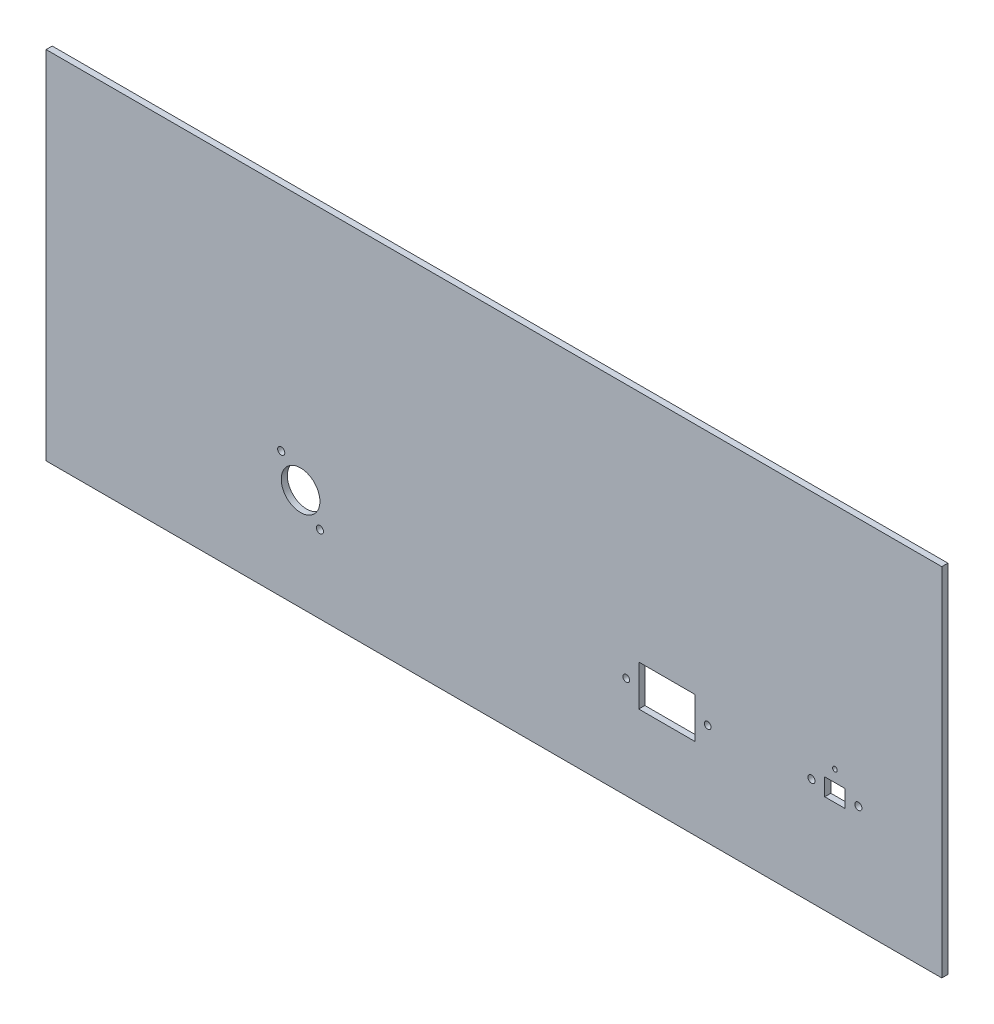
from build123d import *

# Parameters (mm, degrees)
SKETCH1_W           = 440
SKETCH1_H           = 175
SKETCH1_R           = 9.5
SKETCH1_R_2         = 1.75
SKETCH1_R_3         = 1.65
SKETCH1_R_4         = 1.15
SKETCH1_W_2         = 27.7
SKETCH1_H_2         = 20
SKETCH1_W_3         = 10
SKETCH1_H_3         = 8.5
BOSS_EXTRUDE1_DEPTH = 3


with BuildPart() as part:
    # Sketch1 → Boss-Extrude1 (new body)
    with BuildSketch(Plane.XY):
        with Locations((220, 87.5)):
            Rectangle(SKETCH1_W, SKETCH1_H)
        with Locations((125, 50)):
            Circle(SKETCH1_R, mode=Mode.SUBTRACT)
        with Locations((115.5, 62)):
            Circle(SKETCH1_R_2, mode=Mode.SUBTRACT)
        with Locations((134.5, 38)):
            Circle(SKETCH1_R_2, mode=Mode.SUBTRACT)
        with Locations((285, 50)):
            Circle(SKETCH1_R_3, mode=Mode.SUBTRACT)
        with Locations((325, 50)):
            Circle(SKETCH1_R_3, mode=Mode.SUBTRACT)
        with Locations((387.5, 62.593250583)):
            Circle(SKETCH1_R_4, mode=Mode.SUBTRACT)
        with Locations((376, 52.593250583)):
            Circle(SKETCH1_R_2, mode=Mode.SUBTRACT)
        with Locations((399, 52.593250583)):
            Circle(SKETCH1_R_2, mode=Mode.SUBTRACT)
        with Locations((305, 50)):
            Rectangle(SKETCH1_W_2, SKETCH1_H_2, mode=Mode.SUBTRACT)
        with Locations((387.5, 52.593250583)):
            Rectangle(SKETCH1_W_3, SKETCH1_H_3, mode=Mode.SUBTRACT)
    extrude(amount=BOSS_EXTRUDE1_DEPTH)


solid = part.part
